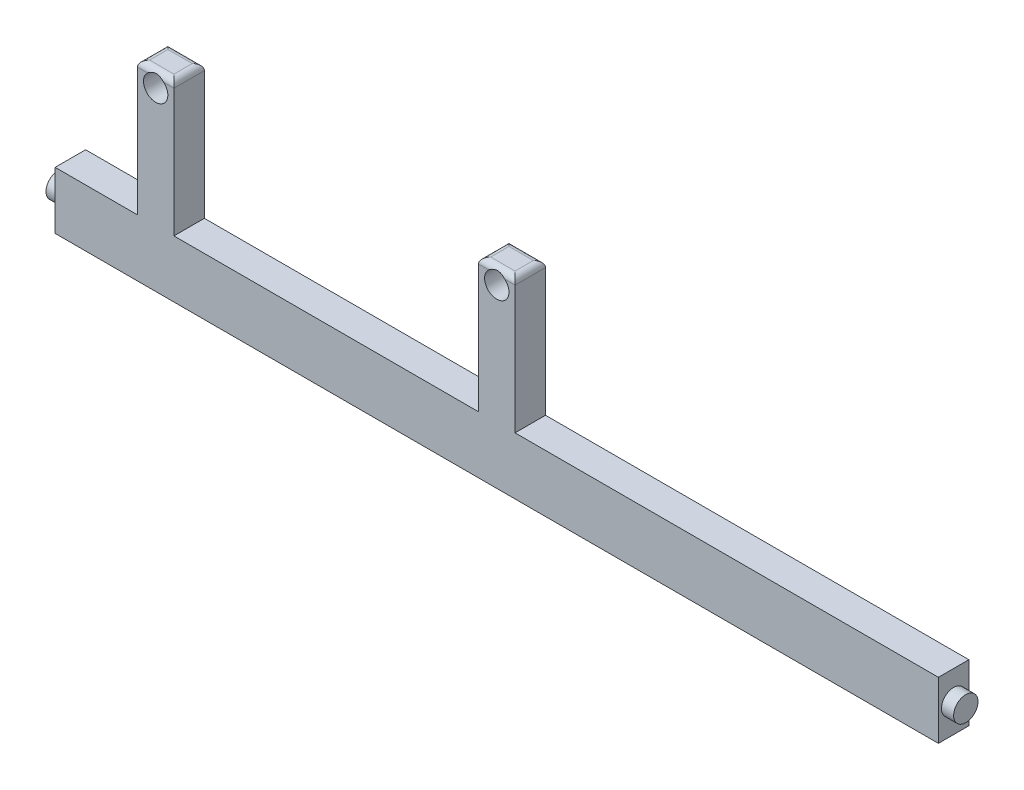
from build123d import *

# Parameters (mm, degrees)
BOSS_EXTRUDE1_DEPTH = 50
SKETCH2_R           = 20
BOSS_EXTRUDE2_DEPTH = 20
BOSS_EXTRUDE3_START = 20
SKETCH3_R           = 20
BOSS_EXTRUDE3_DEPTH = 20
SKETCH4_R           = 20
CUT_EXTRUDE1_DEPTH  = 70
SKETCH5_R           = 20
CUT_EXTRUDE2_DEPTH  = 70
FILLET1_R           = 10


with BuildPart() as part:
    # Sketch1 → Boss-Extrude1 (new body)
    with BuildSketch(Plane.XY):
        Polygon((-76.447024941, -6.493075274), (-76.447024941, 87.506924726), (58.552975059, 87.506924726), (58.552975059, 307.506924726), (118.552975059, 307.506924726), (118.552975059, 87.506924726), (618.552975059, 87.506924726), (618.552975059, 307.506924726), (678.552975059, 307.506924726), (678.552975059, 87.506924726), (1373.552975059, 87.506924726), (1373.552975059, -6.493075274), align=None)
    extrude(amount=BOSS_EXTRUDE1_DEPTH)

    # Sketch2 → Boss-Extrude2 (add)
    with BuildSketch(Plane.ZY.offset(76.447024941)):
        with Locations((25, 40.506924726)):
            Circle(SKETCH2_R)
    extrude(amount=BOSS_EXTRUDE2_DEPTH)

    # Sketch3 → Boss-Extrude3 (add)
    with BuildSketch(Plane(origin=(1373.552975059, 0, 0), x_dir=(0, 0, -1), z_dir=(1, 0, 0)).offset(BOSS_EXTRUDE3_START)):
        with Locations(Location((-25, 40.506924726, 0), (0, 0, 180))):
            Circle(SKETCH3_R)
    extrude(amount=-BOSS_EXTRUDE3_DEPTH)

    # Sketch4 → Cut-Extrude1 (cut)
    with BuildSketch(Plane.XY.offset(50)):
        with Locations((88.552975059, 282.506924726)):
            Circle(SKETCH4_R)
    extrude(amount=-CUT_EXTRUDE1_DEPTH, mode=Mode.SUBTRACT)

    # Sketch5 → Cut-Extrude2 (cut)
    with BuildSketch(Plane.XY.offset(50)):
        with Locations((648.552975059, 282.506924726)):
            Circle(SKETCH5_R)
    extrude(amount=-CUT_EXTRUDE2_DEPTH, mode=Mode.SUBTRACT)

    # Fillet1
    # the kernel refuses this fillet: 10 mm, written as the material it takes off along each edge
    with BuildSketch(Plane(origin=(33.552975059, 307.506924726, 0), x_dir=(0, -1, 0), z_dir=(1, 0, 0)), Plane(origin=(593.552975059, 307.506924726, 0), x_dir=(0, -1, 0), z_dir=(1, 0, 0))) as fillet1_piece_1:
        with BuildLine():
            CenterArc((FILLET1_R, -FILLET1_R), FILLET1_R, 90, 90)
            Line((0, -FILLET1_R), (0, 0))
            Line((0, 0), (FILLET1_R, 0))
        make_face()
    extrude(amount=110, mode=Mode.SUBTRACT)
    with BuildSketch(Plane(origin=(593.552975059, 307.506924726, 50), x_dir=(0, -1, 0), z_dir=(1, 0, 0)), Plane(origin=(33.552975059, 307.506924726, 50), x_dir=(0, -1, 0), z_dir=(1, 0, 0))) as fillet1_piece_2:
        with BuildLine():
            CenterArc((FILLET1_R, FILLET1_R), FILLET1_R, 180, 90)
            Line((0, FILLET1_R), (0, 0))
            Line((0, 0), (FILLET1_R, 0))
        make_face()
    extrude(amount=110, mode=Mode.SUBTRACT)
    with BuildSketch(Plane(origin=(58.552975059, 307.506924726, -25), x_dir=(0, -1, 0), z_dir=(0, 0, 1)), Plane(origin=(118.552975059, 307.506924726, -25), x_dir=(-1, 0, 0), z_dir=(0, 0, 1))) as fillet1_piece_3:
        with BuildLine():
            CenterArc((FILLET1_R, FILLET1_R), FILLET1_R, 180, 90)
            Line((0, FILLET1_R), (0, 0))
            Line((0, 0), (FILLET1_R, 0))
        make_face()
    extrude(amount=100, mode=Mode.SUBTRACT)
    with BuildSketch(Plane(origin=(618.552975059, 307.506924726, -25), x_dir=(1, 0, 0), z_dir=(0, 0, 1)), Plane(origin=(678.552975059, 307.506924726, -25), x_dir=(0, -1, 0), z_dir=(0, 0, 1))) as fillet1_piece_4:
        with BuildLine():
            CenterArc((FILLET1_R, -FILLET1_R), FILLET1_R, 90, 90)
            Line((0, -FILLET1_R), (0, 0))
            Line((0, 0), (FILLET1_R, 0))
        make_face()
    extrude(amount=100, mode=Mode.SUBTRACT)


solid = part.part
